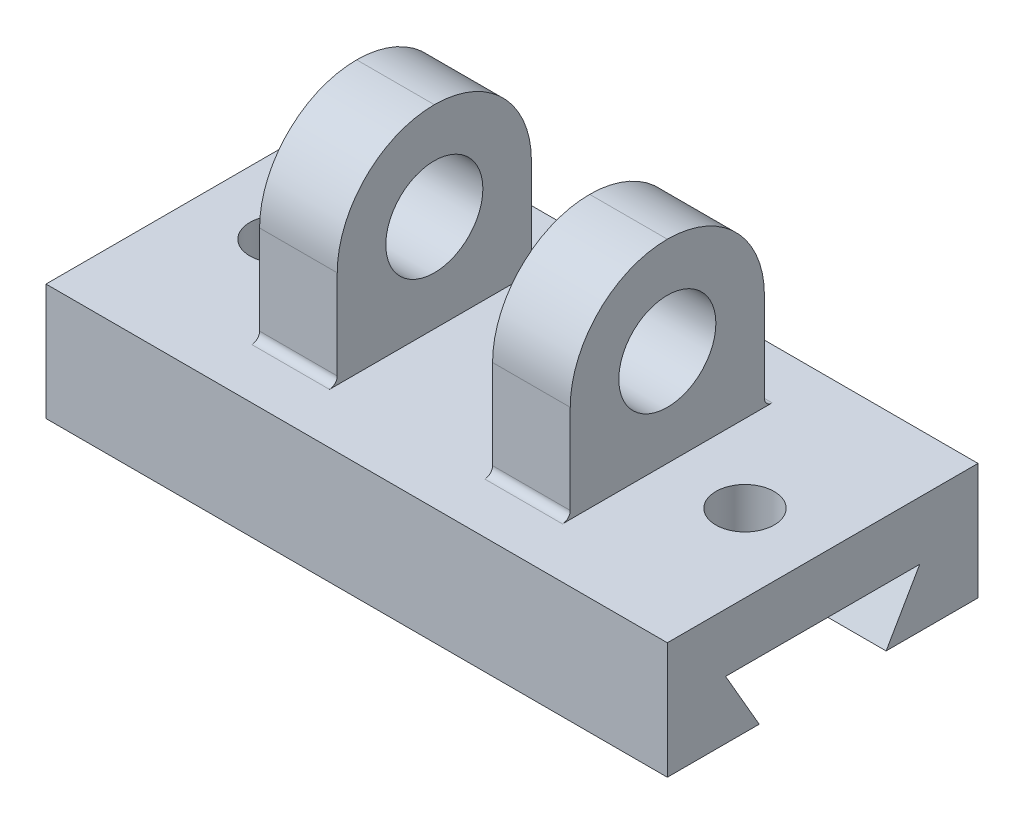
from build123d import *

# Parameters (mm, degrees)
BOSS_EXTRUDE2_DEPTH   = 80
SKETCH3_W             = 20
SKETCH3_H             = 50
BOSS_EXTRUDE3_DEPTH   = 50
FILLET3_R             = 25
SKETCH8_R             = 12.5
CUT_EXTRUDE1_DEPTH    = 50
SKETCH9_R             = 7.5
CUT_EXTRUDE3_DEPTH    = 50
FILLET4_R             = 2
FILLET5_R             = 2
FILLET3_OF_MIRROR14_R = 25
FILLET4_OF_MIRROR14_R = 2
FILLET5_OF_MIRROR14_R = 2


with BuildPart() as part:
    # Sketch1 → Boss-Extrude2 (new body)
    with BuildSketch(Plane(origin=(0, 0, 0), x_dir=(0, 0, -1), z_dir=(1, 0, 0))):
        Polygon((0, 0), (-80, 0), (-80, -30), (-56.339745962, -30), (-65, -15), (-15, -15), (-23.660254038, -30), (0, -30), align=None)
    boss_extrude2 = extrude(amount=BOSS_EXTRUDE2_DEPTH)

    # Sketch3 → Boss-Extrude3 (add)
    with BuildSketch(Plane(origin=(0, 0, 0), x_dir=(1, 0, 0), z_dir=(0, 1, 0))):
        with Locations((30, -40)):
            Rectangle(SKETCH3_W, SKETCH3_H)
    boss_extrude3 = extrude(amount=BOSS_EXTRUDE3_DEPTH)

    # Fillet3
    fillet3_edges = [part.edges().sort_by_distance(p)[0] for p in [
        (30, 50, 65),
        (30, 50, 15),
    ]]
    fillet(fillet3_edges, radius=FILLET3_R - 0.0001)  # a hair under: the kernel refuses the full size

    # Sketch8 → Cut-Extrude1 (cut)
    with BuildSketch(Plane(origin=(40, 0, 0), x_dir=(0, 0, -1), z_dir=(1, 0, 0))):
        with Locations((-40, 25)):
            Circle(SKETCH8_R)
    cut_extrude1 = extrude(amount=-CUT_EXTRUDE1_DEPTH, mode=Mode.SUBTRACT)

    # Sketch9 → Cut-Extrude3 (cut)
    with BuildSketch(Plane(origin=(0, 0, 0), x_dir=(1, 0, 0), z_dir=(0, 1, 0))):
        with Locations(Location((60, -40, 0), (0, 0, 270))):
            Circle(SKETCH9_R)
    cut_extrude3 = extrude(amount=-CUT_EXTRUDE3_DEPTH, mode=Mode.SUBTRACT)

    # Fillet4
    fillet4_edges = [part.edges().sort_by_distance(p)[0] for p in [
        (30, 0, 65),
    ]]
    fillet(fillet4_edges, radius=FILLET4_R)

    # Fillet5
    fillet5_edges = [part.edges().sort_by_distance(p)[0] for p in [
        (30, 0, 15),
    ]]
    fillet(fillet5_edges, radius=FILLET5_R)

    # Mirror14: Boss-Extrude2, Boss-Extrude3, Cut-Extrude1, Cut-Extrude3 across plane
    add(boss_extrude2.mirror(Plane(origin=(0, 0, 0), x_dir=(0, 0, 1), z_dir=(1, 0, 0))))
    add(boss_extrude3.mirror(Plane(origin=(0, 0, 0), x_dir=(0, 0, 1), z_dir=(1, 0, 0))))
    add(cut_extrude1.mirror(Plane(origin=(0, 0, 0), x_dir=(0, 0, 1), z_dir=(1, 0, 0))), mode=Mode.SUBTRACT)
    add(cut_extrude3.mirror(Plane(origin=(0, 0, 0), x_dir=(0, 0, 1), z_dir=(1, 0, 0))), mode=Mode.SUBTRACT)

    # Fillet3 of Mirror14
    fillet3_of_mirror14_edges = [part.edges().sort_by_distance(p)[0] for p in [
        (-30, 50, 65),
        (-30, 50, 15),
    ]]
    fillet(fillet3_of_mirror14_edges, radius=FILLET3_OF_MIRROR14_R - 0.0001)  # a hair under: the kernel refuses the full size

    # Fillet4 of Mirror14
    fillet4_of_mirror14_edges = [part.edges().sort_by_distance(p)[0] for p in [
        (-30, 0, 65),
    ]]
    fillet(fillet4_of_mirror14_edges, radius=FILLET4_OF_MIRROR14_R)

    # Fillet5 of Mirror14
    fillet5_of_mirror14_edges = [part.edges().sort_by_distance(p)[0] for p in [
        (-30, 0, 15),
    ]]
    fillet(fillet5_of_mirror14_edges, radius=FILLET5_OF_MIRROR14_R)


solid = part.part
